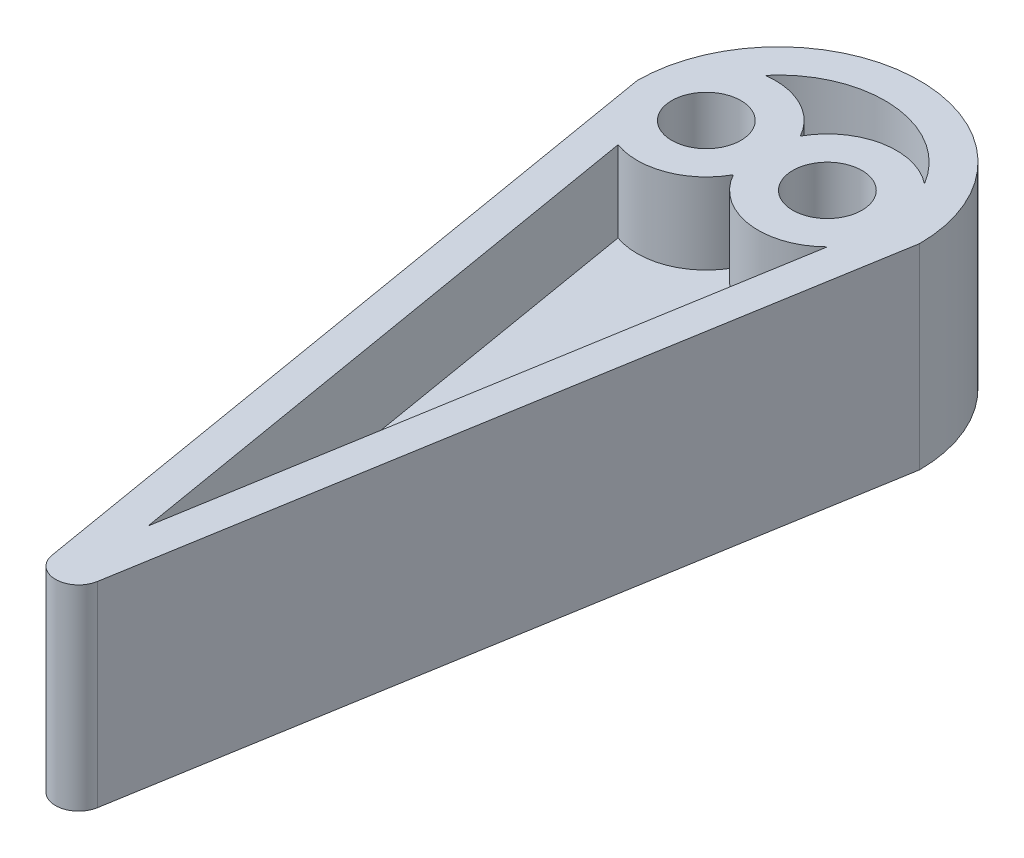
from build123d import *

# Parameters (mm, degrees)
BOSS_EXTRU_1_DEPTH      = 8.5
CONG_2_R                = 2
ESQUISSE2_R             = 3
ENL_V_MAT_EXTRU_1_DEPTH = 65.453547263
COQUE3_START            = 1.5
COQUE3_DEPTH            = 7


# Read off the part's stored shape, not the designer's step: Coque3
with BuildPart() as part:
    # Esquisse1 → Boss.-Extru.1 (new body)
    with BuildSketch(Plane(origin=(0, 0, 0), x_dir=(1, 0, 0), z_dir=(0, 1, 0))):
        with BuildLine():
            Line((-12.25, 0), (0, -72.75))
            Line((0, -72.75), (12.25, 0))
            ThreePointArc((12.25, 0), (0, 12.25), (-12.25, 0))
        make_face()
    extrude(amount=BOSS_EXTRU_1_DEPTH)

    # Congé2
    cong_2_edges = [part.edges().sort_by_distance(p)[0] for p in [
        (0, 4.25, 72.75),
    ]]
    fillet(cong_2_edges, radius=CONG_2_R)

    # Esquisse2 → Enlèv. mat.-Extru.1 (cut, through all)
    with BuildSketch(Plane(origin=(0, 8.5, 0), x_dir=(1, 0, 0), z_dir=(0, 1, 0))):
        with Locations(Location((-6.25, 0, 0), (0, 0, 270))):
            Circle(ESQUISSE2_R)
        with Locations(Location((4.25, 0, 0), (0, 0, 270))):
            Circle(ESQUISSE2_R)
    extrude(amount=-ENL_V_MAT_EXTRU_1_DEPTH, mode=Mode.SUBTRACT)

    # Coque3 outline → Coque3 (cut)
    with BuildSketch(Plane(origin=(0, 0, 0), x_dir=(1, 0, 0), z_dir=(0, 1, 0)).offset(COQUE3_START)):
        with BuildLine():
            ThreePointArc((7.955882353, 4.718732455), (0.74891051, 9.219633021), (-7.09, 5.940909021))
            ThreePointArc((-7.09, 5.940909021), (-3.572947636, 5.369673234), (-1, 2.90473751))
            ThreePointArc((-1, 2.90473751), (3.058899986, 5.880585069), (7.955882353, 4.718732455))
        make_face()
        with BuildLine():
            ThreePointArc((8.493518341, -4.241762852), (3.413244048, -5.941366802), (-1, -2.90473751))
            ThreePointArc((-1, -2.90473751), (-4.123405548, -5.610489821), (-8.255570494, -5.654881696))
            Line((-8.255570494, -5.654881696), (0, -54.68286157))
            Line((0, -54.68286157), (8.493518341, -4.241762852))
        make_face()
    extrude(amount=COQUE3_DEPTH, mode=Mode.SUBTRACT)

    # Symétrie3: part across plane


with BuildPart() as part_1:
    add(part.part)
    add(part.part.mirror(Plane(origin=(0, 0, 0), x_dir=(0, 0, 1), z_dir=(0, -1, 0))))


solid = part_1.part
